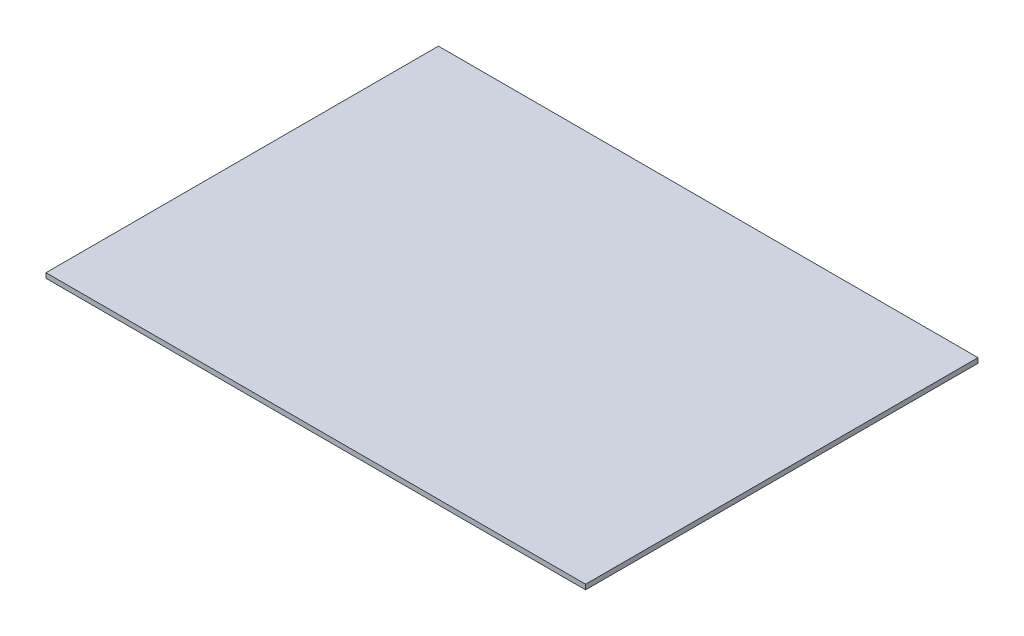
from build123d import *

# Parameters (mm, degrees)
SKETCH_1_W      = 550
SKETCH_1_H      = 400
EXTRUDE_1_DEPTH = 5


with BuildPart() as part:
    # ｽｹｯﾁ1 → ﾎﾞｽ - 押し出し1 (new body)
    with BuildSketch(Plane(origin=(0, 0, 0), x_dir=(1, 0, 0), z_dir=(0, 1, 0))):
        Rectangle(SKETCH_1_W, SKETCH_1_H)
    extrude(amount=EXTRUDE_1_DEPTH)


solid = part.part
